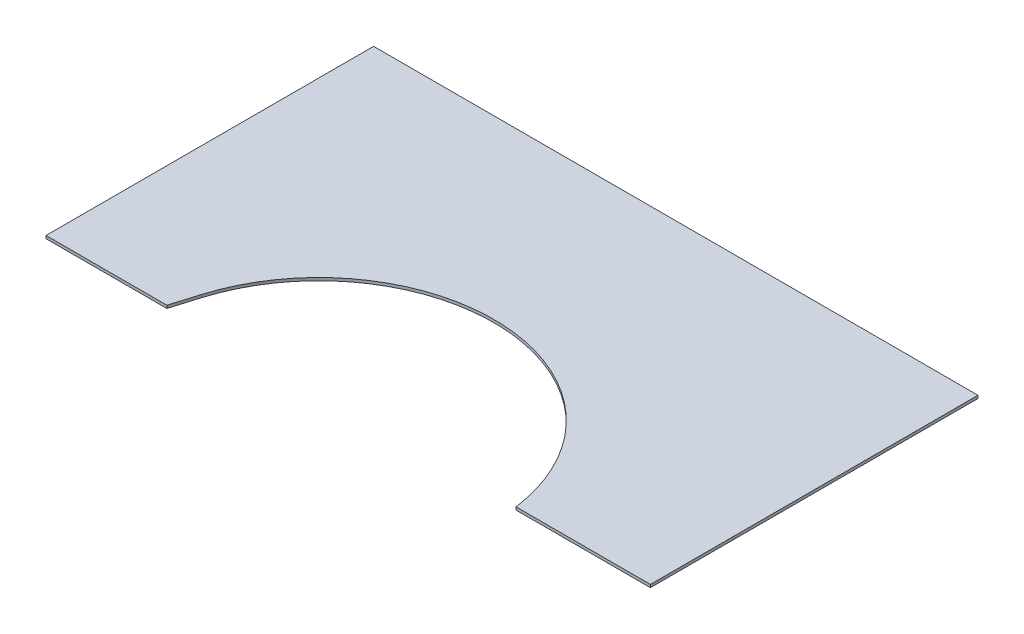
from build123d import *

# Parameters (mm, degrees)
SKETCH1_W           = 679.45
SKETCH1_H           = 368.3
BOSS_EXTRUDE1_DEPTH = 3.175
CUT_EXTRUDE1_DEPTH  = 773.856566981


with BuildPart() as part:
    # Sketch1 → Boss-Extrude1 (new body)
    with BuildSketch(Plane(origin=(0, 0, 0), x_dir=(1, 0, 0), z_dir=(0, 1, 0))):
        with Locations((339.725, 184.15)):
            Rectangle(SKETCH1_W, SKETCH1_H)
    extrude(amount=BOSS_EXTRUDE1_DEPTH)

    # Sketch2 → Cut-Extrude1 (cut, through all)
    with BuildSketch(Plane(origin=(0, 3.175, 0), x_dir=(1, 0, 0), z_dir=(0, 1, 0))):
        with BuildLine():
            Line((135.832993334, 0), (144.943397545, 30.143073778))
            ThreePointArc((144.943397545, 30.143073778), (213.497085422, 129.330172419), (327.025, 169.939300333))
            ThreePointArc((327.025, 169.939300333), (472.568969877, 112.385716223), (530.122553987, -33.158253654))
            ThreePointArc((530.122553987, -33.158253654), (520.134888885, -89.022933623), (494.625079918, -139.71677515))
            add(Edge.make_bspline(
                [(494.625079918, -139.71677515), (493.45726691, -141.384584969), (490.895198527, -144.528294755), (484.77915912, -150.233837552), (475.335730084, -156.231610738), (461.521693133, -161.444305371), (379.648366594, -177.46097032), (267.722400389, -112.187788034), (488.667649379, 0)],
                knots=[0, 0, 0, 0, 0.027722316, 0.055444633, 0.110889265, 0.166333898, 0.22177853, 0.984715491, 0.984715491, 0.984715491, 0.984715491], degree=3))
            Line((488.667649379, 0), (135.832993334, 0))
        make_face()
    extrude(amount=-CUT_EXTRUDE1_DEPTH, mode=Mode.SUBTRACT)


solid = part.part
